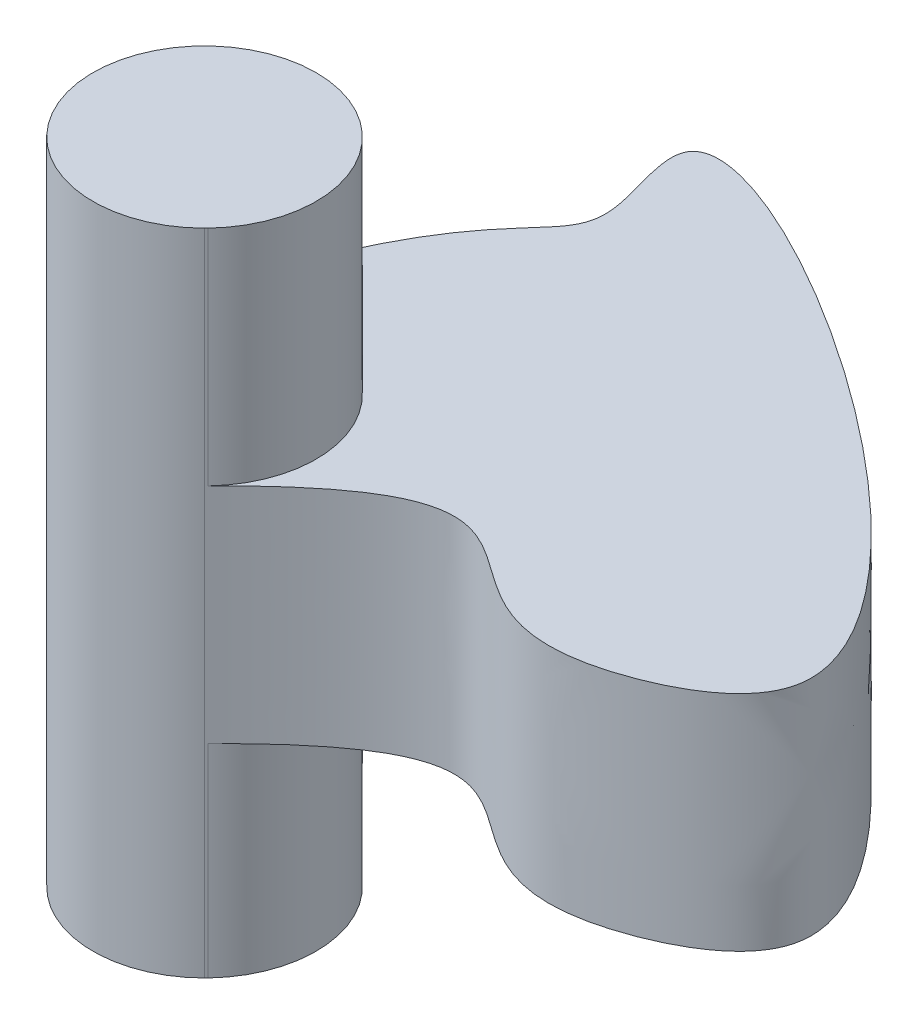
from build123d import *
from build123d.topology import SkipClean

# Parameters (mm, degrees)
BOSS_EXTRUDE1_DEPTH      = 2.2
BOSS_EXTRUDE2_DEPTH      = 4.4
BOSS_EXTRUDE2_DEPTH_BACK = 2
SKETCH1_3_R              = 1.1


# Read off the part's stored shape, not the designer's step: Boss-Extrude1
with BuildPart() as part:
    # Boss-Extrude1 outline → Boss-Extrude1 (new body)
    with BuildSketch(Plane(origin=(0, 0, 0), x_dir=(1, 0, 0), z_dir=(0, 1, 0))):
        with BuildLine():
            add(Edge.make_bspline(
                [(-1.062518409, 0.28470095), (-0.305026322, 3.431720958), (0.846331831, 2.700890511), (-0.378004135, 5.836685644), (7.055036287, 0.98277003), (2.452880714, -1.474586746), (2.969016894, 1.471140538), (0.777817459, -0.777817459)],
                knots=[0, 0, 0, 0, 0.225062079, 0.283845432, 0.554057068, 0.62905017, 1, 1, 1, 1], degree=3))
            ThreePointArc((-1.062518409, 0.28470095), (-0.55, -0.952627944), (0.777817459, -0.777817459))
        make_face()
    extrude(amount=BOSS_EXTRUDE1_DEPTH)

    # Sketch1<3> → Boss-Extrude2 (add, two sides: drawn at the far end of the back side and taken through both)
    with SkipClean():  # the faces are left unmerged after this step: merging them gives an invalid solid
        with BuildSketch(Plane(origin=(0, 0, 0), x_dir=(1, 0, 0), z_dir=(0, 1, 0)).offset(-BOSS_EXTRUDE2_DEPTH_BACK)):
            Circle(SKETCH1_3_R)
        extrude(amount=BOSS_EXTRUDE2_DEPTH + BOSS_EXTRUDE2_DEPTH_BACK)


solid = part.part
